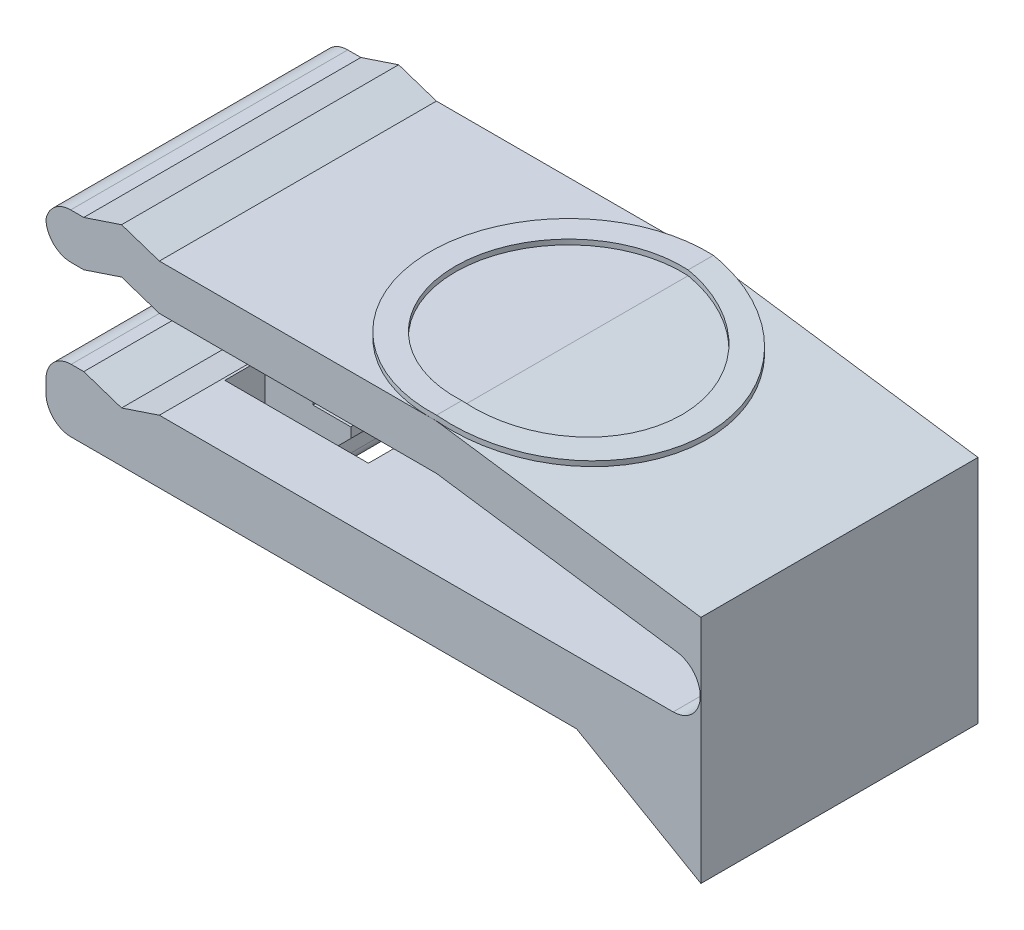
from build123d import *

# Parameters (mm, degrees)
BOSS_EXTRUDE1_DEPTH   = 11
BOSS_EXTRUDE1_2_DEPTH = 11
SKETCH2_W             = 5.7
SKETCH2_H             = 6
CUT_EXTRUDE1_DEPTH    = 3
BOSS_EXTRUDE8_DEPTH   = 11
BOSS_EXTRUDE2_DEPTH   = 6
BOSS_EXTRUDE3_START   = -5.5
BOSS_EXTRUDE3_DEPTH   = 2.5
FILLET7_R             = 1
FILLET8_R             = 1
FILLET10_R            = 1
FILLET11_R            = 1
FILLET12_R            = 0.5
BOSS_EXTRUDE7_REACH   = 36.321
BOSS_EXTRUDE7_START   = 5.5
SKETCH6_R             = 5.5
SKETCH6_R_2           = 4.5
CUT_EXTRUDE3_DEPTH    = 29.820825804
BOSS_EXTRUDE9_DEPTH   = 11


with BuildPart() as part:
    # Sketch1 → Boss-Extrude1 (new body)
    with BuildSketch(Plane.XY):
        Polygon((0, 3.8), (0, 2), (-10.5, 3.5), (-21.5, 3.5), (-23, 4), (-24.5, 3.5), (-26, 3.5), (-26, 5.3), (-24.5, 5.3), (-23, 5.8), (-21.5, 5.3), (-10.5, 5.3), align=None)
    extrude(amount=BOSS_EXTRUDE1_DEPTH)



with BuildPart() as body_2:
    # Sketch1 → Boss-Extrude1 2 (new body)
    with BuildSketch(Plane.XY):
        Polygon((0, 0), (0, -2.5), (-26, -2.5), (-26, 0), (-24.5, 0), (-23, -0.5), (-21.5, 0), align=None)
    extrude(amount=BOSS_EXTRUDE1_2_DEPTH)

    # Sketch2 → Cut-Extrude1 (cut)
    with BuildSketch(Plane.XZ.offset(2.5)):
        with Locations((-18.55, 5.5)):
            Rectangle(SKETCH2_W, SKETCH2_H)
    extrude(amount=-CUT_EXTRUDE1_DEPTH, mode=Mode.SUBTRACT)


with BuildPart() as part_1:
    add(part.part)

    add(body_2.part)  # Boss-Extrude8 merges body 2
    # Sketch8 → Boss-Extrude8 (add)
    with BuildSketch(Plane(origin=(0, 0, 0), x_dir=(-1, 0, 0), z_dir=(0, 0, -1))):
        with BuildLine():
            Line((0.948237354, 2.135462479), (0, 2))
            Line((0, 2), (0, 0))
            Line((0, 0), (1.1, 0))
            ThreePointArc((1.1, 0), (0.029575797, 0.997051253), (0.948237354, 2.135462479))
        make_face()
    extrude(amount=-BOSS_EXTRUDE8_DEPTH)

    # Sketch3 → Boss-Extrude2 (add)
    with BuildSketch(Plane.XY.offset(2.5)):
        Polygon((-15.7, 0), (-17.7, -2), (-17.7, -2.5), (-15.7, -2.5), align=None)
    extrude(amount=BOSS_EXTRUDE2_DEPTH)

    # Sketch4 → Boss-Extrude3 (add, symmetric)
    with BuildSketch(Plane.XY.offset(11).offset(BOSS_EXTRUDE3_START)):
        with BuildLine():
            Line((-18.9, -2), (-16.9, 0))
            Line((-16.9, 0), (-16.9, 0.4))
            Line((-16.9, 0.4), (-18.4, 0.4))
            Line((-18.4, 0.4), (-18.4, 1.9))
            ThreePointArc((-18.4, 1.9), (-17.93137085, 3.03137085), (-16.8, 3.5))
            Line((-16.8, 3.5), (-20.3, 3.5))
            Line((-20.3, 3.5), (-20.3, -3))
            Line((-20.3, -3), (-18.9, -3))
            Line((-18.9, -3), (-18.9, -2))
        make_face()
    extrude(amount=BOSS_EXTRUDE3_DEPTH, both=True)

    # Fillet7
    fillet7_edges = [part_1.edges().sort_by_distance(p)[0] for p in [
        (-26, 0, 5.5),
    ]]
    fillet(fillet7_edges, radius=FILLET7_R)

    # Fillet8
    fillet8_edges = [part_1.edges().sort_by_distance(p)[0] for p in [
        (-26, 3.5, 5.5),
    ]]
    fillet(fillet8_edges, radius=FILLET8_R)

    # Fillet10
    # the kernel refuses this fillet: 1 mm, written as the material it takes off along each edge
    with BuildSketch(Plane(origin=(-26, 5.3, -2.449489743), x_dir=(1.6120438317551944e-12, -1.0, 0), z_dir=(0, 0, 1))) as fillet10_piece_1:
        with BuildLine():
            CenterArc((1, 0.979795897), FILLET10_R, 180, 78.463040967)
            Line((0, 0.979795897), (-0.02, 0.979795897))
            Line((-0.02, 0.979795897), (-0.02, 0))
            Line((-0.02, 0), (0, -0.02))
            ThreePointArc((0, -0.02), (0.4, -0.02), (0.796, -0.019595918))
            Line((0.796, -0.019595918), (0.8, 0))
        make_face()
    extrude(amount=15.898979486, mode=Mode.SUBTRACT)

    # Fillet11
    fillet11_edges = [part_1.edges().sort_by_distance(p)[0] for p in [
        (-26, -2.5, 5.5),
    ]]
    fillet(fillet11_edges, radius=FILLET11_R)

    # Fillet12
    fillet12_edges = [part_1.edges().sort_by_distance(p)[0] for p in [
        (-18.9, -3, 5.5),
        (-20.3, -3, 5.5),
    ]]
    fillet(fillet12_edges, radius=FILLET12_R)

    # Sketch6 → Boss-Extrude7 (add, up to next)
    with BuildSketch(Plane(origin=(0, 0, 0), x_dir=(1, 0, 0), z_dir=(0, 1, 0)).offset(BOSS_EXTRUDE7_START), mode=Mode.PRIVATE) as boss_extrude7_sk1:
        with Locations(Location((-10.75, -5.5, 0), (0, 0, 270))):
            Circle(SKETCH6_R)
        with Locations(Location((-10.75, -5.5, 0), (0, 0, 270))):
            Circle(SKETCH6_R_2, mode=Mode.SUBTRACT)
    boss_extrude7_tool1 = extrude(boss_extrude7_sk1.sketch, amount=-BOSS_EXTRUDE7_REACH, mode=Mode.PRIVATE) - part_1.part
    add(boss_extrude7_tool1.solids().sort_by_distance((-10.75, 5.5, 0.155563))[0])

    # Sketch7 → Cut-Extrude3 (cut, through all)
    with BuildSketch(Plane.XY):
        Polygon((-10.5, 5.5), (-0.5, 4.071428571), (-0.5, 5.5), align=None)
    extrude(amount=CUT_EXTRUDE3_DEPTH, mode=Mode.SUBTRACT)

    # Sketch10 → Boss-Extrude9 (add)
    with BuildSketch(Plane(origin=(0, 0, 0), x_dir=(-1, 0, 0), z_dir=(0, 0, -1))):
        Polygon((0, -2.5), (4.936344802, -2.5), (0, -5.35), align=None)
    extrude(amount=-BOSS_EXTRUDE9_DEPTH)


solid = part_1.part
